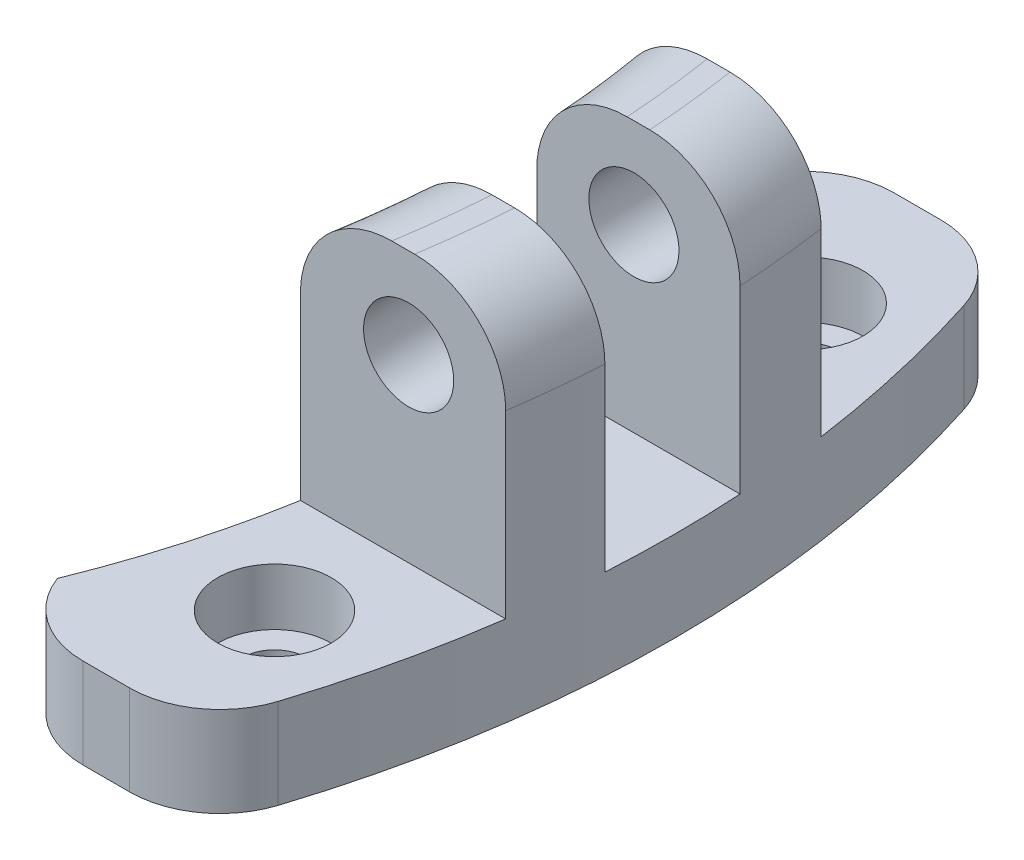
from build123d import *

# Parameters (mm, degrees)
SKETCH1_W                      = 19.05
SKETCH1_H                      = 57.15
BOSS_EXTRUDE1_DEPTH            = 25.4
SKETCH8_R                      = 65.0875
CUT_EXTRUDE2_DEPTH             = 89.102674477
SKETCH2_W                      = 17.4625
SKETCH2_H                      = 19.05
SKETCH2_W_2                    = 9.525
CUT_EXTRUDE1_DEPTH             = 43.715256349
CBORE_FOR_M4_SHCS1_D           = 4.5
CBORE_FOR_M4_SHCS1_CBORE_D     = 8
CBORE_FOR_M4_SHCS1_CBORE_DEPTH = 4
SKETCH9_R                      = 3.175
CUT_EXTRUDE3_DEPTH             = 93.307357677
CUT_EXTRUDE4_START             = -6.35
CUT_EXTRUDE4_DEPTH             = 25.4
FILLET1_R                      = 6.35
FILLET2_R                      = 6.35


# Read off the part's stored shape, not the designer's step: Cut-Extrude4
with BuildPart() as part:
    # Sketch1 → Boss-Extrude1 (new body)
    with BuildSketch(Plane(origin=(0, 0, 0), x_dir=(1, 0, 0), z_dir=(0, 1, 0))):
        with Locations((69.85, 0)):
            Rectangle(SKETCH1_W, SKETCH1_H)
    extrude(amount=BOSS_EXTRUDE1_DEPTH)

    # Sketch8 → Cut-Extrude2 (cut, through all)
    with BuildSketch(Plane(origin=(0, 25.4, 0), x_dir=(1, 0, 0), z_dir=(0, 1, 0))):
        Circle(SKETCH8_R)
    extrude(amount=-CUT_EXTRUDE2_DEPTH, mode=Mode.SUBTRACT)

    # Sketch2 → Cut-Extrude1 (cut, through all)
    with BuildSketch(Plane(origin=(79.375, 0, 0), x_dir=(0, 0, -1), z_dir=(1, 0, 0))):
        with Locations((-19.84375, 15.875)):
            Rectangle(SKETCH2_W, SKETCH2_H)
        with Locations((0, 15.875)):
            Rectangle(SKETCH2_W_2, SKETCH2_H)
        with Locations((19.84375, 15.875)):
            Rectangle(SKETCH2_W, SKETCH2_H)
    extrude(amount=-CUT_EXTRUDE1_DEPTH, mode=Mode.SUBTRACT)

    # CBORE for M4 SHCS1 (through all)
    with Locations(Plane(origin=(0, 6.35, 0), x_dir=(1, 0, 0), z_dir=(0, 1, 0))):
        with Locations((69.923370565, -18.735910675), (69.923370565, 18.735910675)):
            CounterBoreHole(CBORE_FOR_M4_SHCS1_D / 2, CBORE_FOR_M4_SHCS1_CBORE_D / 2, CBORE_FOR_M4_SHCS1_CBORE_DEPTH)

    # Sketch9 → Cut-Extrude3 (cut, through all)
    with BuildSketch(Plane.XY.offset(11.1125)):
        with Locations(Location((71.753428179, 19.05, 0), (0, 0, 90))):
            Circle(SKETCH9_R)
    extrude(amount=-CUT_EXTRUDE3_DEPTH, mode=Mode.SUBTRACT)

    # Cut-Extrude4 outline → Cut-Extrude4 (cut)
    with BuildSketch(Plane(origin=(0, 6.35, 0), x_dir=(1, 0, 0), z_dir=(0, 1, 0)).offset(CUT_EXTRUDE4_START)):
        with BuildLine():
            ThreePointArc((74.053089065, 28.575), (78.033180665, 14.533180665), (79.375, 0))
            Line((79.375, 0), (79.375, 28.575))
            Line((79.375, 28.575), (74.053089065, 28.575))
        make_face()
        with BuildLine():
            ThreePointArc((79.375, 0), (78.033180665, -14.533180665), (74.053089065, -28.575))
            Line((74.053089065, -28.575), (79.375, -28.575))
            Line((79.375, -28.575), (79.375, 0))
        make_face()
    extrude(amount=CUT_EXTRUDE4_DEPTH, mode=Mode.SUBTRACT)

    # Fillet1
    fillet1_edges = [part.edges().sort_by_distance(p)[0] for p in [
        (78.976482118, 25.4, 7.943922032),
        (78.976482118, 25.4, -7.943922032),
        (64.600512324, 25.4, 7.947104106),
        (64.600512324, 25.4, -7.947104106),
    ]]
    fillet(fillet1_edges, radius=FILLET1_R)

    # Fillet2
    # the kernel refuses this fillet: 6.35 mm, written as the material it takes off along each edge
    with BuildSketch(Plane(origin=(60.325, -14.878589634, -28.575), x_dir=(1, 0, 0), z_dir=(0, 1, 0))) as fillet2_piece_1:
        with BuildLine():
            CenterArc((5.951435854, -6.35), FILLET2_R, 90, 69.592112093)
            Line((0, -4.135748145), (-0.119028717, -4.091463108))
            ThreePointArc((-0.119028717, -4.091463108), (-0.127, -2.067874072), (-0.127, 0))
            Line((-0.127, 0), (0, 0.127))
            Line((0, 0.127), (5.951435854, 0.127))
            Line((5.951435854, 0.127), (5.951435854, 0))
        make_face()
    extrude(amount=36.107179269, mode=Mode.SUBTRACT)
    with BuildSketch(Plane(origin=(74.053089065, -11.708929515, -28.575), x_dir=(0.33231857215714583, 0, 0.9431671997050343), z_dir=(0, 1, 0))) as fillet2_piece_2:
        with BuildLine():
            CenterArc((4.496228934, -6.347235827), FILLET2_R, 88.309367925, 72.281068131)
            Line((-1.492882784, -4.237012894), (-1.612665019, -4.194808436))
            Line((-1.612665019, -4.194808436), (-0.119782234, 0.042204459))
            Line((-0.119782234, 0.042204459), (-0.003746857, 0.126944717))
            ThreePointArc((-0.003746857, 0.126944717), (2.341785903, 0.161552158), (4.687318663, 0.126944717))
            Line((4.687318663, 0.126944717), (4.683571806, 0))
        make_face()
    extrude(amount=29.76785903, mode=Mode.SUBTRACT)
    with BuildSketch(Plane(origin=(60.325, -14.878589634, 28.575), x_dir=(1, 0, 0), z_dir=(0, 1, 0))) as fillet2_piece_3:
        with BuildLine():
            CenterArc((5.951435854, 6.35), FILLET2_R, 200.407887907, 69.592112093)
            Line((0, 4.135748145), (-0.119028717, 4.091463108))
            ThreePointArc((-0.119028717, 4.091463108), (-0.127, 2.067874072), (-0.127, 0))
            Line((-0.127, 0), (0, -0.127))
            Line((0, -0.127), (5.951435854, -0.127))
            Line((5.951435854, -0.127), (5.951435854, 0))
        make_face()
    extrude(amount=36.107179269, mode=Mode.SUBTRACT)
    with BuildSketch(Plane(origin=(74.053089065, -11.708929515, 28.575), x_dir=(0.3323185721571436, 0, -0.943167199705035), z_dir=(0, 1, 0))) as fillet2_piece_4:
        with BuildLine():
            CenterArc((4.496228934, 6.347235827), FILLET2_R, 199.409563944, 72.281068131)
            Line((-1.492882784, 4.237012894), (-1.612665019, 4.194808436))
            Line((-1.612665019, 4.194808436), (-0.119782234, -0.042204459))
            Line((-0.119782234, -0.042204459), (-0.003746857, -0.126944717))
            ThreePointArc((-0.003746857, -0.126944717), (2.341785903, -0.161552158), (4.687318663, -0.126944717))
            Line((4.687318663, -0.126944717), (4.683571806, 0))
        make_face()
    extrude(amount=29.76785903, mode=Mode.SUBTRACT)


solid = part.part
